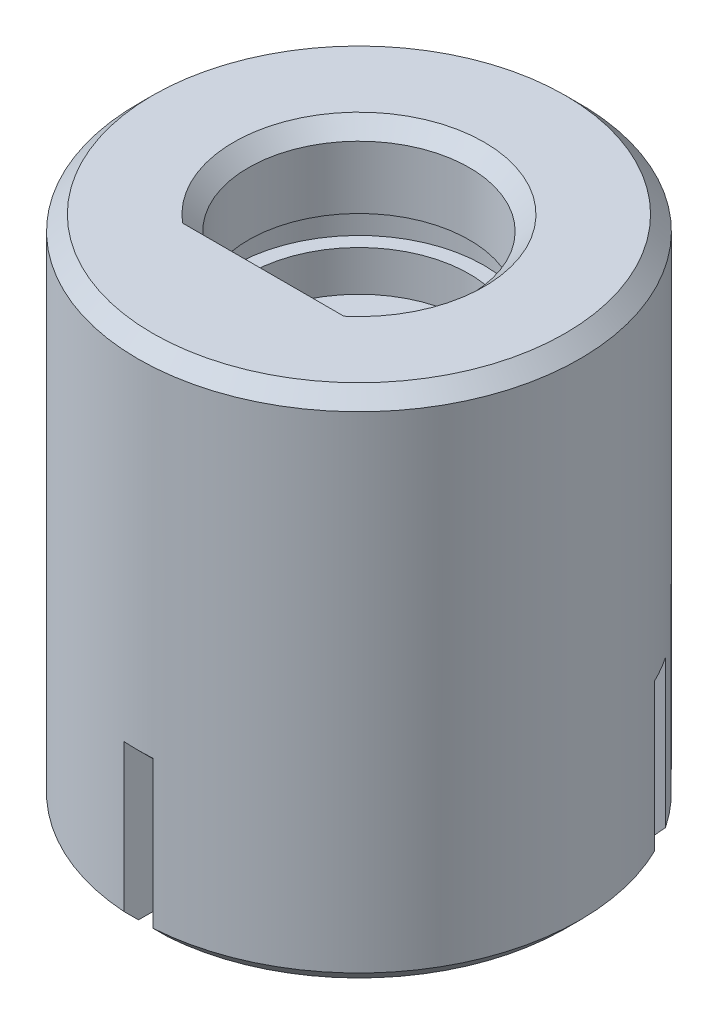
from build123d import *

# Parameters (mm, degrees)
SKETCH1_R           = 15
BOSS_EXTRUDE2_DEPTH = 25
CUT_EXTRUDE1_DEPTH  = 10
SKETCH4_R           = 15
CUT_EXTRUDE2_DEPTH  = 15
CHAMFER1_SIZE       = 1
CHAMFER3_SIZE       = 1
CUT_EXTRUDE4_DEPTH  = 10
CUT_EXTRUDE5_DEPTH  = 1
CHAMFER5_SIZE       = 1


with BuildPart() as part:
    # Sketch1 → Boss-Extrude2 (new, symmetric)
    with BuildSketch(Plane(origin=(0, 0, 0), x_dir=(1, 0, 0), z_dir=(0, 1, 0))):
        with Locations(Location((0, 0, 0), (0, 0, 270))):
            Circle(SKETCH1_R)
    extrude(amount=BOSS_EXTRUDE2_DEPTH, both=True)

    # Sketch2 → Cut-Revolve1 (revolve, cut)
    with BuildSketch(Plane(origin=(0, 0, 0), x_dir=(0, 0, -1), z_dir=(1, 0, 0))):
        with BuildLine():
            Line((0, -9.125), (0, -25))
            Line((0, -25), (9.742785793, -25))
            ThreePointArc((9.742785793, -25), (10.709672947, -15.930380229), (4.636809248, -9.125))
            Line((4.636809248, -9.125), (0, -9.125))
        make_face()
    revolve(axis=Axis((0, -9.125, 0), (0, -1, 0)), mode=Mode.SUBTRACT)

    # Sketch3 → Cut-Extrude1 (cut)
    with BuildSketch(Plane(origin=(0, -25, 0), x_dir=(-1, 0, 0), z_dir=(0, -1, 0))):
        Polygon((19.052558883, 11), (18.552558883, 11.866025404), (9.892304845, 6.866025404), (0, 1.154700538), (-9.892304845, 6.866025404), (-18.552558883, 11.866025404), (-19.052558883, 11), (-19.552558883, 10.133974596), (-10.892304845, 5.133974596), (-1, -0.577350269), (-1, -12), (-1, -22), (0, -22), (1, -22), (1, -12), (1, -0.577350269), (10.892304845, 5.133974596), (19.552558883, 10.133974596), align=None)
    extrude(amount=-CUT_EXTRUDE1_DEPTH, mode=Mode.SUBTRACT)

    # Sketch4 → Cut-Extrude2 (cut)
    with BuildSketch(Plane(origin=(0, 25, 0), x_dir=(1, 0, 0), z_dir=(0, 1, 0))):
        with Locations(Location((0, 0, 0), (0, 0, 270))):
            Circle(SKETCH4_R)
    extrude(amount=-CUT_EXTRUDE2_DEPTH, mode=Mode.SUBTRACT)

    # Chamfer1
    chamfer1_edges = [part.edges().sort_by_distance(p)[0] for p in [
        (0, -25, -15),
        (-12.990381057, -25, 7.5),
        (12.990381057, -25, 7.5),
    ]]
    chamfer(chamfer1_edges, length=CHAMFER1_SIZE)

    # Chamfer3
    chamfer3_edges = [part.edges().sort_by_distance(p)[0] for p in [
        (12.990381057, -15, -7.5),
        (0.500278319, -15, 14.991655066),
        (-12.990381057, -15, -7.5),
    ]]
    chamfer(chamfer3_edges, length=CHAMFER3_SIZE)

    # Chamfer4: read off the stored shape, not the designer's step
    # Chamfer4 outline → Chamfer4 (revolve, cut)
    with BuildSketch(Plane.XY):
        Polygon((10.907310457, -25), (10.212304822, -24.094251023), (0, -24.094251023), (0, -25), align=None)
    revolve(axis=Axis((0, 0, 0), (0, 1, 0)), mode=Mode.SUBTRACT)

    # Sketch5 → Cut-Extrude4 (cut)
    with BuildSketch(Plane(origin=(0, 10, 0), x_dir=(1, 0, 0), z_dir=(0, 1, 0))):
        with BuildLine():
            Line((-5.099019514, -5.5), (5.099019514, -5.5))
            ThreePointArc((5.099019514, -5.5), (0, 7.5), (-5.099019514, -5.5))
        make_face()
    extrude(amount=-CUT_EXTRUDE4_DEPTH, mode=Mode.SUBTRACT)

    # Sketch7 → Cut-Extrude5 (cut, symmetric)
    with BuildSketch(Plane(origin=(0, 3.75, 0), x_dir=(1, 0, 0), z_dir=(0, 1, 0))):
        with BuildLine():
            Line((-5.477225575, -6.5), (5.477225575, -6.5))
            ThreePointArc((5.477225575, -6.5), (0, 8.5), (-5.477225575, -6.5))
        make_face()
    extrude(amount=CUT_EXTRUDE5_DEPTH, both=True, mode=Mode.SUBTRACT)

    # Chamfer5
    chamfer5_edges = [part.edges().sort_by_distance(p)[0] for p in [
        (0, 10, -7.5),
        (0, 10, 5.5),
        (0, 10, -15),
    ]]
    chamfer(chamfer5_edges, length=CHAMFER5_SIZE)


solid = part.part
